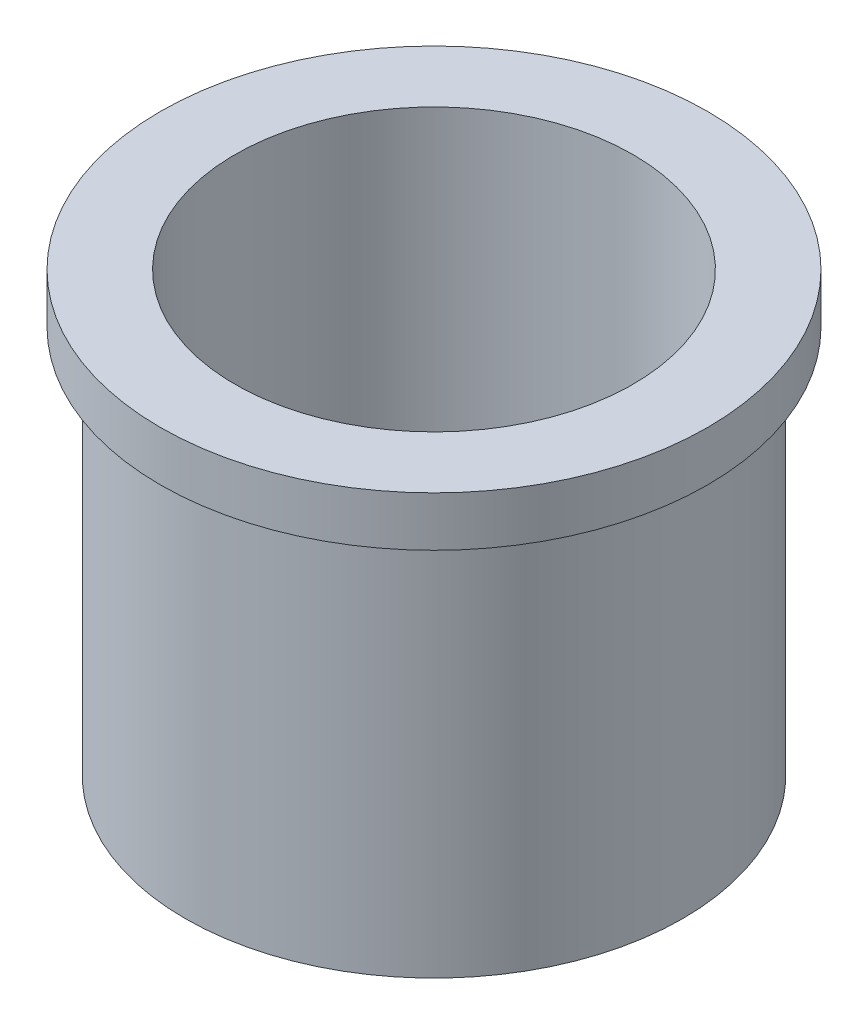
from build123d import *

# Parameters (mm, degrees)
SKETCH1_R           = 12.7
BOSS_EXTRUDE1_DEPTH = 19.812
SKETCH2_R           = 13.97
BOSS_EXTRUDE2_DEPTH = 2.54
SKETCH3_R           = 10.16
CUT_EXTRUDE1_DEPTH  = 30.831756636


with BuildPart() as part:
    # Sketch1 → Boss-Extrude1 (new body)
    with BuildSketch(Plane(origin=(0, 0, 0), x_dir=(1, 0, 0), z_dir=(0, 1, 0))):
        Circle(SKETCH1_R)
    extrude(amount=BOSS_EXTRUDE1_DEPTH)

    # Sketch2 → Boss-Extrude2 (add)
    with BuildSketch(Plane(origin=(0, 19.812, 0), x_dir=(1, 0, 0), z_dir=(0, 1, 0))):
        Circle(SKETCH2_R)
    extrude(amount=BOSS_EXTRUDE2_DEPTH)

    # Sketch3 → Cut-Extrude1 (cut, through all)
    with BuildSketch(Plane.XZ):
        Circle(SKETCH3_R)
    extrude(amount=-CUT_EXTRUDE1_DEPTH, mode=Mode.SUBTRACT)


solid = part.part
